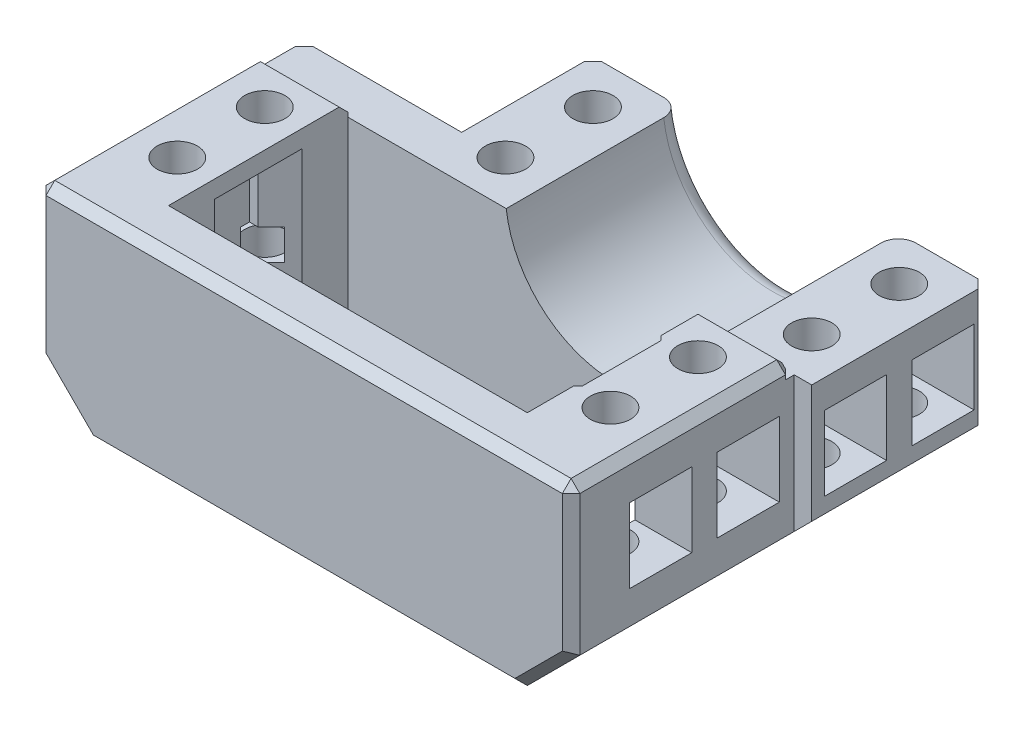
from build123d import *

# Parameters (mm, degrees)
SKETCH1_W           = 41
SKETCH1_H           = 20.5
BOSS_EXTRUDE1_DEPTH = 23
SKETCH2_R           = 12.5
CUT_EXTRUDE1_DEPTH  = 20
SKETCH3_W           = 20
SKETCH3_H           = 23
BOSS_EXTRUDE2_DEPTH = 2
CUT_EXTRUDE2_REACH  = 52.003
SKETCH4_R           = 2.3
CUT_EXTRUDE3_REACH  = 52.003
SKETCH5_R           = 2.3
CUT_EXTRUDE4_DEPTH  = 15
CUT_EXTRUDE5_START  = -9
SKETCH7_W           = 7.1
SKETCH7_H           = 3.5
CUT_EXTRUDE5_DEPTH  = 68.898747864
FILLET1_R           = 2
SKETCH8_W           = 7.1
SKETCH8_H           = 3.5
CUT_EXTRUDE6_DEPTH  = 9
CHAMFER2_SIZE       = 5
CHAMFER4_SIZE       = 5
CHAMFER5_SIZE       = 1
CHAMFER6_SIZE       = 6
CHAMFER7_SIZE       = 1
CUT_EXTRUDE7_START  = -10
SKETCH9_W           = 64.406379258
SKETCH9_H           = 20
CUT_EXTRUDE7_DEPTH  = 1.5
CHAMFER8_SIZE       = 1
CUT_EXTRUDE8_REACH  = 69.32
CUT_EXTRUDE8_START  = -12
CHAMFER9_SIZE       = 2.5


with BuildPart() as part:
    # Sketch1 → Boss-Extrude1 (new body)
    with BuildSketch(Plane(origin=(0, 0, 0), x_dir=(1, 0, 0), z_dir=(0, 1, 0))):
        Polygon((0, -15.25), (-30.5, -15.25), (-30.5, 30.25), (30.5, 30.25), (30.5, -15.25), align=None)
        Rectangle(SKETCH1_W, SKETCH1_H, mode=Mode.SUBTRACT)
    extrude(amount=BOSS_EXTRUDE1_DEPTH)

    # Sketch2 → Cut-Extrude1 (cut)
    with BuildSketch(Plane(origin=(0, 0, -30.25), x_dir=(-1, 0, 0), z_dir=(0, 0, -1))):
        with Locations((-10, 23)):
            Circle(SKETCH2_R)
    extrude(amount=-CUT_EXTRUDE1_DEPTH, mode=Mode.SUBTRACT)

    # Sketch3 → Boss-Extrude2 (add)
    with BuildSketch(Plane(origin=(30.5, 0, 0), x_dir=(0, 0, -1), z_dir=(1, 0, 0))):
        with Locations((20.25, 11.5)):
            Rectangle(SKETCH3_W, SKETCH3_H)
    extrude(amount=BOSS_EXTRUDE2_DEPTH)

    # Sketch4 → Cut-Extrude2 (cut, up to next)
    with BuildSketch(Plane(origin=(0, 23, 0), x_dir=(1, 0, 0), z_dir=(0, 1, 0)), mode=Mode.PRIVATE) as cut_extrude2_sk1:
        with Locations(Location((-7.5, 25.25, 0), (0, 0, 270))):
            Circle(SKETCH4_R)
    cut_extrude2_tool1 = extrude(cut_extrude2_sk1.sketch, amount=-CUT_EXTRUDE2_REACH, mode=Mode.PRIVATE) & part.part
    # Sketch4 → Cut-Extrude2 (cut, up to next)
    with BuildSketch(Plane(origin=(0, 23, 0), x_dir=(1, 0, 0), z_dir=(0, 1, 0)), mode=Mode.PRIVATE) as cut_extrude2_sk2:
        with Locations(Location((-7.5, 15.25, 0), (0, 0, 270))):
            Circle(SKETCH4_R)
    cut_extrude2_tool2 = extrude(cut_extrude2_sk2.sketch, amount=-CUT_EXTRUDE2_REACH, mode=Mode.PRIVATE) & part.part
    # Sketch4 → Cut-Extrude2 (cut, up to next)
    with BuildSketch(Plane(origin=(0, 23, 0), x_dir=(1, 0, 0), z_dir=(0, 1, 0)), mode=Mode.PRIVATE) as cut_extrude2_sk3:
        with Locations(Location((27.5, 25.25, 0), (0, 0, 270))):
            Circle(SKETCH4_R)
    cut_extrude2_tool3 = extrude(cut_extrude2_sk3.sketch, amount=-CUT_EXTRUDE2_REACH, mode=Mode.PRIVATE) & part.part
    # Sketch4 → Cut-Extrude2 (cut, up to next)
    with BuildSketch(Plane(origin=(0, 23, 0), x_dir=(1, 0, 0), z_dir=(0, 1, 0)), mode=Mode.PRIVATE) as cut_extrude2_sk4:
        with Locations(Location((27.5, 15.25, 0), (0, 0, 270))):
            Circle(SKETCH4_R)
    cut_extrude2_tool4 = extrude(cut_extrude2_sk4.sketch, amount=-CUT_EXTRUDE2_REACH, mode=Mode.PRIVATE) & part.part
    add(cut_extrude2_tool1.solids().sort_by_distance((-7.5, 23, -25.25))[0], mode=Mode.SUBTRACT)
    add(cut_extrude2_tool2.solids().sort_by_distance((-7.5, 23, -15.25))[0], mode=Mode.SUBTRACT)
    add(cut_extrude2_tool3.solids().sort_by_distance((27.5, 23, -25.25))[0], mode=Mode.SUBTRACT)
    add(cut_extrude2_tool4.solids().sort_by_distance((27.5, 23, -15.25))[0], mode=Mode.SUBTRACT)

    # Sketch5 → Cut-Extrude3 (cut, up to next)
    with BuildSketch(Plane(origin=(0, 23, 0), x_dir=(1, 0, 0), z_dir=(0, 1, 0)), mode=Mode.PRIVATE) as cut_extrude3_sk1:
        with Locations(Location((24.75, 5, 0), (0, 0, 270))):
            Circle(SKETCH5_R)
    cut_extrude3_tool1 = extrude(cut_extrude3_sk1.sketch, amount=-CUT_EXTRUDE3_REACH, mode=Mode.PRIVATE) & part.part
    # Sketch5 → Cut-Extrude3 (cut, up to next)
    with BuildSketch(Plane(origin=(0, 23, 0), x_dir=(1, 0, 0), z_dir=(0, 1, 0)), mode=Mode.PRIVATE) as cut_extrude3_sk2:
        with Locations(Location((24.75, -5, 0), (0, 0, 270))):
            Circle(SKETCH5_R)
    cut_extrude3_tool2 = extrude(cut_extrude3_sk2.sketch, amount=-CUT_EXTRUDE3_REACH, mode=Mode.PRIVATE) & part.part
    cut_extrude3_1 = cut_extrude3_tool1.solids().sort_by_distance((24.75, 23, -5))[0]
    add(cut_extrude3_1, mode=Mode.SUBTRACT)
    cut_extrude3_2 = cut_extrude3_tool2.solids().sort_by_distance((24.75, 23, 5))[0]
    add(cut_extrude3_2, mode=Mode.SUBTRACT)
    cut_extrude3 = cut_extrude3_1 + cut_extrude3_2  # Cut-Extrude3 as one shape, for the pattern or mirror that repeats it

    # Mirror1: Cut-Extrude3 across plane
    add(cut_extrude3.mirror(Plane(origin=(0, 0, 0), x_dir=(0, 0, 1), z_dir=(1, 0, 0))), mode=Mode.SUBTRACT)

    # Sketch6 → Cut-Extrude4 (cut)
    with BuildSketch(Plane(origin=(0, 0, -30.25), x_dir=(-1, 0, 0), z_dir=(0, 0, -1))):
        Polygon((12.5, 23), (12.5, 19), (12.5, 4), (12.5, 0), (30.5, 0), (30.5, 4), (30.5, 19), (30.5, 23), align=None)
    extrude(amount=-CUT_EXTRUDE4_DEPTH, mode=Mode.SUBTRACT)

    # Sketch7 → Cut-Extrude5 (cut)
    with BuildSketch(Plane.ZY.offset(12.5).offset(CUT_EXTRUDE5_START)):
        with Locations((-25.25, 11.5)):
            Rectangle(SKETCH7_W, SKETCH7_H)
        with Locations((-15.25, 11.5)):
            Rectangle(SKETCH7_W, SKETCH7_H)
    cut_extrude5 = extrude(amount=CUT_EXTRUDE5_DEPTH, mode=Mode.SUBTRACT)

    # Fillet1
    fillet1_edges = [part.edges().sort_by_distance(p)[0] for p in [
        (10, 10.5, -30.25),
    ]]
    fillet(fillet1_edges, radius=FILLET1_R)

    # Mirror2: Cut-Extrude5 across plane
    add(cut_extrude5.mirror(Plane.ZY.offset(-10)), mode=Mode.SUBTRACT)

    # Sketch8 → Cut-Extrude6 (cut)
    with BuildSketch(Plane(origin=(30.5, 0, 0), x_dir=(0, 0, -1), z_dir=(1, 0, 0))):
        with Locations((-5, 11.5)):
            Rectangle(SKETCH8_W, SKETCH8_H)
        with Locations((5, 11.5)):
            Rectangle(SKETCH8_W, SKETCH8_H)
    cut_extrude6 = extrude(amount=-CUT_EXTRUDE6_DEPTH, mode=Mode.SUBTRACT)

    # Mirror3: Cut-Extrude6 across plane
    add(cut_extrude6.mirror(Plane(origin=(0, 0, 0), x_dir=(0, 0, 1), z_dir=(1, 0, 0))), mode=Mode.SUBTRACT)

    # Chamfer2
    # the kernel refuses this chamfer: 5 mm, written as the material it takes off along each edge
    with BuildSketch(Plane(origin=(-12.5, 13.25, -8.84158506), x_dir=(-0.027495876610586317, 0.9996219169112968, 0), z_dir=(0, 0, -1))) as chamfer2_piece_1_section:
        Polygon((CHAMFER2_SIZE * 0.999621916911, CHAMFER2_SIZE * 0.0274958766106), (-CHAMFER2_SIZE * 0.0274958766106, CHAMFER2_SIZE * 0.999621916911), (0, 0), align=None)
    chamfer2_piece_1 = extrude(amount=32.81682988, mode=Mode.PRIVATE)
    chamfer2_piece_1 = split(chamfer2_piece_1, bisect_by=Plane(origin=(-11.032350108, 15.016175054, -15.25), z_dir=(0, 0, -1)), keep=Keep.TOP, mode=Mode.PRIVATE)
    chamfer2_piece_1 = split(chamfer2_piece_1, bisect_by=Plane(origin=(-11.032350108, 15.016175054, -18.8), z_dir=(0, 0, 1)), keep=Keep.TOP, mode=Mode.PRIVATE)
    add(chamfer2_piece_1, mode=Mode.SUBTRACT)
    with BuildSketch(Plane(origin=(-12.5, 13.25, -21.7), x_dir=(-0.027495876610586327, 0.9996219169112968, 0), z_dir=(0, 0, -1)), Plane(origin=(32.5, 13.25, -18.8), x_dir=(0.027495876610586317, 0.9996219169112968, 0), z_dir=(0, 0, 1)), Plane(origin=(32.5, 13.25, -28.8), x_dir=(0.027495876610586327, 0.9996219169112968, 0), z_dir=(0, 0, 1)), Plane(origin=(30.5, 13.25, 1.45), x_dir=(0.027495876610586317, 0.9996219169112968, 0), z_dir=(0, 0, 1)), Plane(origin=(-30.5, 13.25, -1.45), x_dir=(-0.027495876610586317, 0.9996219169112968, 0), z_dir=(0, 0, -1))) as chamfer2_piece_2:
        Polygon((CHAMFER2_SIZE * 0.999621916911, CHAMFER2_SIZE * 0.0274958766106), (-CHAMFER2_SIZE * 0.0274958766106, CHAMFER2_SIZE * 0.999621916911), (0, 0), align=None)
    extrude(amount=7.1, mode=Mode.SUBTRACT)
    with BuildSketch(Plane(origin=(-12.5, 13.25, -15.25), x_dir=(-0.027495876610586327, 0.9996219169112968, 0), z_dir=(0, 0, -1))) as chamfer2_piece_3:
        Polygon((CHAMFER2_SIZE * 0.999621916911, CHAMFER2_SIZE * 0.0274958766106), (-CHAMFER2_SIZE * 0.0274958766106, CHAMFER2_SIZE * 0.999621916911), (0, 0), align=None)
    extrude(amount=3.55, mode=Mode.SUBTRACT)
    with BuildSketch(Plane(origin=(-12.5, 13.25, -2.39158506), x_dir=(-0.02749587661058631, 0.9996219169112968, 0), z_dir=(0, 0, -1))) as chamfer2_piece_4_section:
        Polygon((CHAMFER2_SIZE * 0.999621916911, CHAMFER2_SIZE * 0.0274958766106), (-CHAMFER2_SIZE * 0.0274958766106, CHAMFER2_SIZE * 0.999621916911), (0, 0), align=None)
    chamfer2_piece_4 = extrude(amount=29.26682988, mode=Mode.PRIVATE)
    chamfer2_piece_4 = split(chamfer2_piece_4, bisect_by=Plane(origin=(-11.032350109, 15.016175054, -21.7), z_dir=(0, 0, -1)), keep=Keep.TOP, mode=Mode.PRIVATE)
    chamfer2_piece_4 = split(chamfer2_piece_4, bisect_by=Plane(origin=(-11.032350109, 15.016175054, -28.8), z_dir=(0, 0, 1)), keep=Keep.TOP, mode=Mode.PRIVATE)
    add(chamfer2_piece_4, mode=Mode.SUBTRACT)
    with BuildSketch(Plane(origin=(32.5, 13.25, -31.65841494), x_dir=(0.027495876610586317, 0.9996219169112968, 0), z_dir=(0, 0, 1))) as chamfer2_piece_5_section:
        Polygon((CHAMFER2_SIZE * 0.999621916911, CHAMFER2_SIZE * 0.0274958766106), (-CHAMFER2_SIZE * 0.0274958766106, CHAMFER2_SIZE * 0.999621916911), (0, 0), align=None)
    chamfer2_piece_5 = extrude(amount=32.81682988, mode=Mode.PRIVATE)
    chamfer2_piece_5 = split(chamfer2_piece_5, bisect_by=Plane(origin=(31.583333333, 15.291666667, -28.8), z_dir=(0, 0, 1)), keep=Keep.TOP, mode=Mode.PRIVATE)
    chamfer2_piece_5 = split(chamfer2_piece_5, bisect_by=Plane(origin=(31.583333333, 15.291666667, -21.7), z_dir=(0, 0, -1)), keep=Keep.TOP, mode=Mode.PRIVATE)
    add(chamfer2_piece_5, mode=Mode.SUBTRACT)
    with BuildSketch(Plane(origin=(32.5, 13.25, -31.65841494), x_dir=(0.027495876610586317, 0.9996219169112968, 0), z_dir=(0, 0, 1))) as chamfer2_piece_6_section:
        Polygon((CHAMFER2_SIZE * 0.999621916911, CHAMFER2_SIZE * 0.0274958766106), (-CHAMFER2_SIZE * 0.0274958766106, CHAMFER2_SIZE * 0.999621916911), (0, 0), align=None)
    chamfer2_piece_6 = extrude(amount=32.81682988, mode=Mode.PRIVATE)
    chamfer2_piece_6 = split(chamfer2_piece_6, bisect_by=Plane(origin=(29.5, 14.25, -8.55), z_dir=(0, 0, 1)), keep=Keep.TOP, mode=Mode.PRIVATE)
    chamfer2_piece_6 = split(chamfer2_piece_6, bisect_by=Plane(origin=(29.5, 14.25, -1.45), z_dir=(0, 0, -1)), keep=Keep.TOP, mode=Mode.PRIVATE)
    add(chamfer2_piece_6, mode=Mode.SUBTRACT)
    with BuildSketch(Plane(origin=(32.5, 13.25, -41.65841494), x_dir=(0.02749587661058631, 0.9996219169112968, 0), z_dir=(0, 0, 1))) as chamfer2_piece_7_section:
        Polygon((CHAMFER2_SIZE * 0.999621916911, CHAMFER2_SIZE * 0.0274958766106), (-CHAMFER2_SIZE * 0.0274958766106, CHAMFER2_SIZE * 0.999621916911), (0, 0), align=None)
    chamfer2_piece_7 = extrude(amount=32.81682988, mode=Mode.PRIVATE)
    chamfer2_piece_7 = split(chamfer2_piece_7, bisect_by=Plane(origin=(31.583333333, 15.291666667, -18.8), z_dir=(0, 0, 1)), keep=Keep.TOP, mode=Mode.PRIVATE)
    chamfer2_piece_7 = split(chamfer2_piece_7, bisect_by=Plane(origin=(31.583333333, 15.291666667, -11.7), z_dir=(0, 0, -1)), keep=Keep.TOP, mode=Mode.PRIVATE)
    add(chamfer2_piece_7, mode=Mode.SUBTRACT)
    with BuildSketch(Plane(origin=(30.5, 13.25, -11.40841494), x_dir=(0.027495876610586317, 0.9996219169112968, 0), z_dir=(0, 0, 1))) as chamfer2_piece_8_section:
        Polygon((CHAMFER2_SIZE * 0.999621916911, CHAMFER2_SIZE * 0.0274958766106), (-CHAMFER2_SIZE * 0.0274958766106, CHAMFER2_SIZE * 0.999621916911), (0, 0), align=None)
    chamfer2_piece_8 = extrude(amount=32.81682988, mode=Mode.PRIVATE)
    chamfer2_piece_8 = split(chamfer2_piece_8, bisect_by=Plane(origin=(28.923121447, 14.961560723, -8.55), z_dir=(0, 0, 1)), keep=Keep.TOP, mode=Mode.PRIVATE)
    chamfer2_piece_8 = split(chamfer2_piece_8, bisect_by=Plane(origin=(28.923121447, 14.961560723, -1.45), z_dir=(0, 0, -1)), keep=Keep.TOP, mode=Mode.PRIVATE)
    add(chamfer2_piece_8, mode=Mode.SUBTRACT)
    with BuildSketch(Plane(origin=(30.5, 13.25, 11.40841494), x_dir=(0.027495876610586317, 0.9996219169112968, 0), z_dir=(0, 0, -1))) as chamfer2_piece_9_section:
        Polygon((CHAMFER2_SIZE * 0.999621916911, -CHAMFER2_SIZE * 0.0274958766106), (-CHAMFER2_SIZE * 0.0274958766106, -CHAMFER2_SIZE * 0.999621916911), (0, 0), align=None)
    chamfer2_piece_9 = extrude(amount=32.81682988, mode=Mode.PRIVATE)
    chamfer2_piece_9 = split(chamfer2_piece_9, bisect_by=Plane(origin=(28.923121447, 14.961560723, 1.45), z_dir=(0, 0, 1)), keep=Keep.TOP, mode=Mode.PRIVATE)
    chamfer2_piece_9 = split(chamfer2_piece_9, bisect_by=Plane(origin=(28.923121447, 14.961560723, 8.55), z_dir=(0, 0, -1)), keep=Keep.TOP, mode=Mode.PRIVATE)
    add(chamfer2_piece_9, mode=Mode.SUBTRACT)
    with BuildSketch(Plane(origin=(30.5, 13.25, -1.45), x_dir=(0.027495876610586317, 0.9996219169112968, 0), z_dir=(0, 0, -1)), Plane(origin=(-30.5, 13.25, 1.45), x_dir=(-0.027495876610586317, 0.9996219169112968, 0), z_dir=(0, 0, 1))) as chamfer2_piece_10:
        Polygon((CHAMFER2_SIZE * 0.999621916911, -CHAMFER2_SIZE * 0.0274958766106), (-CHAMFER2_SIZE * 0.0274958766106, -CHAMFER2_SIZE * 0.999621916911), (0, 0), align=None)
    extrude(amount=7.1, mode=Mode.SUBTRACT)
    with BuildSketch(Plane(origin=(-30.5, 13.25, -11.40841494), x_dir=(-0.027495876610586317, 0.9996219169112968, 0), z_dir=(0, 0, 1))) as chamfer2_piece_11_section:
        Polygon((CHAMFER2_SIZE * 0.999621916911, -CHAMFER2_SIZE * 0.0274958766106), (-CHAMFER2_SIZE * 0.0274958766106, -CHAMFER2_SIZE * 0.999621916911), (0, 0), align=None)
    chamfer2_piece_11 = extrude(amount=32.81682988, mode=Mode.PRIVATE)
    chamfer2_piece_11 = split(chamfer2_piece_11, bisect_by=Plane(origin=(-28.923121447, 14.961560723, -1.45), z_dir=(0, 0, -1)), keep=Keep.TOP, mode=Mode.PRIVATE)
    chamfer2_piece_11 = split(chamfer2_piece_11, bisect_by=Plane(origin=(-28.923121447, 14.961560723, -8.55), z_dir=(0, 0, 1)), keep=Keep.TOP, mode=Mode.PRIVATE)
    add(chamfer2_piece_11, mode=Mode.SUBTRACT)
    with BuildSketch(Plane(origin=(-30.5, 13.25, 11.40841494), x_dir=(-0.027495876610586317, 0.9996219169112968, 0), z_dir=(0, 0, -1))) as chamfer2_piece_12_section:
        Polygon((CHAMFER2_SIZE * 0.999621916911, CHAMFER2_SIZE * 0.0274958766106), (-CHAMFER2_SIZE * 0.0274958766106, CHAMFER2_SIZE * 0.999621916911), (0, 0), align=None)
    chamfer2_piece_12 = extrude(amount=32.81682988, mode=Mode.PRIVATE)
    chamfer2_piece_12 = split(chamfer2_piece_12, bisect_by=Plane(origin=(-28.923121447, 14.961560723, 8.55), z_dir=(0, 0, -1)), keep=Keep.TOP, mode=Mode.PRIVATE)
    chamfer2_piece_12 = split(chamfer2_piece_12, bisect_by=Plane(origin=(-28.923121447, 14.961560723, 1.45), z_dir=(0, 0, 1)), keep=Keep.TOP, mode=Mode.PRIVATE)
    add(chamfer2_piece_12, mode=Mode.SUBTRACT)

    # Chamfer3
    # the kernel refuses this chamfer: 8 mm, written as the material it takes off along each edge
    with BuildSketch(Plane(origin=(32.5, 0, 39.126313369), x_dir=(-0.9996219169112968, -0.027495876610586365, 0), z_dir=(0, 0, -1))) as chamfer3_piece_1:
        with BuildLine():
            Line((8.229385561, 0), (-0.452377239, 8.216942348))
            Line((-0.452377239, 8.216942348), (-0.612316746, 8.212543008))
            ThreePointArc((-0.612316746, 8.212543008), (-0.273033816, 4.107182637), (-0.159939507, -0.00439934))
            Line((-0.159939507, -0.00439934), (0.00439934, -0.159939507))
            ThreePointArc((0.00439934, -0.159939507), (4.115981318, -0.046845197), (8.233784902, -0.159939507))
            Line((8.233784902, -0.159939507), (8.229385561, 0))
        make_face()
    extrude(amount=118.752626738, mode=Mode.SUBTRACT)

    # Chamfer4
    # the kernel refuses this chamfer: 5 mm, written as the material it takes off along each edge
    with BuildSketch(Plane(origin=(-12.5, 0, -43.10841494), x_dir=(-0.027495876610586317, 0.9996219169112968, 0), z_dir=(0, 0, 1))) as chamfer4_piece_1:
        Polygon((CHAMFER4_SIZE * 0.999621916911, -CHAMFER4_SIZE * 0.0274958766106), (-CHAMFER4_SIZE * 0.0274958766106, -CHAMFER4_SIZE * 0.999621916911), (0, 0), align=None)
    extrude(amount=27.85841494, mode=Mode.SUBTRACT)

    # Chamfer5
    chamfer5_edges = [part.edges().sort_by_distance(p)[0] for p in [
        (-12.5, 14, -30.25),
        (32.5, 15.5, -30.25),
        (8.5, 0, -30.25),
        (28.5, 4, -30.25),
        (-10, 2.5, -30.25),
    ]]
    chamfer(chamfer5_edges, length=CHAMFER5_SIZE)

    # Chamfer6
    # the kernel refuses this chamfer: 6 mm, written as the material it takes off along each edge
    with BuildSketch(Plane(origin=(-30.5, 0, 30.680097928), x_dir=(-0.027495876610586202, 0.9996219169112968, 0), z_dir=(0, 0, -1))) as chamfer6_piece_1:
        Polygon((CHAMFER6_SIZE * 0.999621916911, CHAMFER6_SIZE * 0.0274958766106), (-CHAMFER6_SIZE * 0.0274958766106, CHAMFER6_SIZE * 0.999621916911), (0, 0), align=None)
    extrude(amount=61.360195856, mode=Mode.SUBTRACT)

    # Chamfer7
    chamfer7_edges = [part.edges().sort_by_distance(p)[0] for p in [
        (-17.15, 0, -15.25),
        (-30.5, 18.125, -15.25),
        (-21.5, 9.75, -15.25),
        (-20.15, 13.25, -15.25),
        (27.5, 3, 15.25),
        (-30.5, 7.875, -15.25),
        (0, 0, 15.25),
        (-27.5, 3, 15.25),
        (-27.5, 3, -15.25),
        (0, 23, 15.25),
        (30.5, 23, 2.5),
        (-30.5, 23, 0),
        (-30.5, 14.5, 15.25),
        (30.5, 14.5, 15.25),
    ]]
    chamfer(chamfer7_edges, length=CHAMFER7_SIZE)

    # Sketch9 → Cut-Extrude7 (cut)
    with BuildSketch(Plane(origin=(0, 33, 0), x_dir=(1, 0, 0), z_dir=(0, 1, 0)).offset(CUT_EXTRUDE7_START)):
        with Locations((0.296810371, 20.25)):
            Rectangle(SKETCH9_W, SKETCH9_H)
    extrude(amount=-CUT_EXTRUDE7_DEPTH, mode=Mode.SUBTRACT)

    # Chamfer8
    chamfer8_edges = [part.edges().sort_by_distance(p)[0] for p in [
        (25, 23, -10.25),
        (30.5, 21.75, -10.25),
        (30, 22.5, -10.25),
        (-25, 23, -10.25),
        (-30, 22.5, -10.25),
        (-30.5, 21.75, -10.25),
    ]]
    chamfer(chamfer8_edges, length=CHAMFER8_SIZE)

    # Sketch10 → Cut-Extrude8 (cut, up to next)
    with BuildSketch(Plane(origin=(0, 33, 0), x_dir=(1, 0, 0), z_dir=(0, 1, 0)).offset(CUT_EXTRUDE8_START), mode=Mode.PRIVATE) as cut_extrude8_sk1:
        Polygon((-20.5, 2.5), (-24, 2.5), (-24, -2.5), (-20.5, -2.5), (-20.5, 0), align=None)
    cut_extrude8_tool1 = extrude(cut_extrude8_sk1.sketch, amount=-CUT_EXTRUDE8_REACH, mode=Mode.PRIVATE) & part.part
    cut_extrude8 = cut_extrude8_tool1.solids().sort_by_distance((-22.25, 21, 0))[0]
    add(cut_extrude8, mode=Mode.SUBTRACT)

    # Chamfer9
    # the kernel refuses this chamfer: 2.5 mm, written as the material it takes off along each edge
    with BuildSketch(Plane(origin=(-20.5, 21, 2.5), x_dir=(0.027495876610586317, 0, 0.9996219169112968), z_dir=(0, -1, 0))) as chamfer9_piece_1:
        Polygon((CHAMFER9_SIZE * 0.999621916911, CHAMFER9_SIZE * 0.0274958766106), (-CHAMFER9_SIZE * 0.0274958766106, CHAMFER9_SIZE * 0.999621916911), (0, 0), align=None)
    extrude(amount=27.42920747, mode=Mode.SUBTRACT)
    with BuildSketch(Plane(origin=(-20.5, 21, -2.5), x_dir=(0.027495876610586324, 0, -0.9996219169112968), z_dir=(0, -1, 0))) as chamfer9_piece_2:
        Polygon((CHAMFER9_SIZE * 0.999621916911, -CHAMFER9_SIZE * 0.0274958766106), (-CHAMFER9_SIZE * 0.0274958766106, -CHAMFER9_SIZE * 0.999621916911), (0, 0), align=None)
    extrude(amount=27.42920747, mode=Mode.SUBTRACT)

    # Mirror4: Cut-Extrude8 across plane
    add(cut_extrude8.mirror(Plane(origin=(0, 0, 0), x_dir=(0, 0, 1), z_dir=(1, 0, 0))), mode=Mode.SUBTRACT)

    # Chamfer10
    # the kernel refuses this chamfer: 2.5 mm, written as the material it takes off along each edge
    with BuildSketch(Plane(origin=(20.5, 21, -2.5), x_dir=(-0.027495876610586324, 0, -0.9996219169112968), z_dir=(0, -1, 0))) as chamfer10_piece_1:
        with BuildLine():
            Line((2.571682988, 0), (-0.141367887, 2.567794484))
            Line((-0.141367887, 2.567794484), (-0.191348983, 2.56641969))
            ThreePointArc((-0.191348983, 2.56641969), (-0.085323068, 1.283494574), (-0.049981096, -0.001374794))
            Line((-0.049981096, -0.001374794), (0.001374794, -0.049981096))
            ThreePointArc((0.001374794, -0.049981096), (1.286244162, -0.014639124), (2.573057782, -0.049981096))
            Line((2.573057782, -0.049981096), (2.571682988, 0))
        make_face()
    extrude(amount=21, mode=Mode.SUBTRACT)
    with BuildSketch(Plane(origin=(20.5, 21, -2.5), x_dir=(-0.027495876610586317, 0.9996219169112968, 0), z_dir=(0, 0, 1))) as chamfer10_piece_2:
        with BuildLine():
            Line((2.571682988, 0), (-0.141367887, -2.567794484))
            Line((-0.141367887, -2.567794484), (-0.191348983, -2.56641969))
            ThreePointArc((-0.191348983, -2.56641969), (-0.085323068, -1.283494574), (-0.049981096, 0.001374794))
            Line((-0.049981096, 0.001374794), (0.001374794, 0.049981096))
            ThreePointArc((0.001374794, 0.049981096), (1.286244162, 0.014639124), (2.573057782, 0.049981096))
            Line((2.573057782, 0.049981096), (2.571682988, 0))
        make_face()
    extrude(amount=5, mode=Mode.SUBTRACT)
    with BuildSketch(Plane(origin=(20.5, 21, 2.5), x_dir=(-0.027495876610586317, 0, 0.9996219169112968), z_dir=(0, -1, 0))) as chamfer10_piece_3:
        with BuildLine():
            Line((2.571682988, 0), (-0.141367887, -2.567794484))
            Line((-0.141367887, -2.567794484), (-0.191348983, -2.56641969))
            ThreePointArc((-0.191348983, -2.56641969), (-0.085323068, -1.283494574), (-0.049981096, 0.001374794))
            Line((-0.049981096, 0.001374794), (0.001374794, 0.049981096))
            ThreePointArc((0.001374794, 0.049981096), (1.286244162, 0.014639124), (2.573057782, 0.049981096))
            Line((2.573057782, 0.049981096), (2.571682988, 0))
        make_face()
    extrude(amount=21, mode=Mode.SUBTRACT)
    with BuildSketch(Plane(origin=(20.5, 27.42920747, -2.5), x_dir=(-0.027495876610586317, 0, -0.9996219169112968), z_dir=(0, -1, 0))) as chamfer10_piece_4a_section:
        with BuildLine():
            Line((2.571682988, 0), (-0.141367887, 2.567794484))
            Line((-0.141367887, 2.567794484), (-0.191348983, 2.56641969))
            ThreePointArc((-0.191348983, 2.56641969), (-0.085323068, 1.283494574), (-0.049981096, -0.001374794))
            Line((-0.049981096, -0.001374794), (0.001374794, -0.049981096))
            ThreePointArc((0.001374794, -0.049981096), (1.286244162, -0.014639124), (2.573057782, -0.049981096))
            Line((2.573057782, -0.049981096), (2.571682988, 0))
        make_face()
    chamfer10_piece_4a = extrude(amount=27.42920747, mode=Mode.PRIVATE)
    chamfer10_piece_4a = split(chamfer10_piece_4a, bisect_by=Plane(origin=(21.324484067, 21, -3.324484067), z_dir=(0, 1, 0)), keep=Keep.TOP, mode=Mode.PRIVATE)
    with BuildSketch(Plane(origin=(20.5, 21, -8.92920747), x_dir=(-0.027495876610586317, 0.9996219169112968, 0), z_dir=(0, 0, 1))) as chamfer10_piece_4b_section:
        with BuildLine():
            Line((2.571682988, 0), (-0.141367887, -2.567794484))
            Line((-0.141367887, -2.567794484), (-0.191348983, -2.56641969))
            ThreePointArc((-0.191348983, -2.56641969), (-0.085323068, -1.283494574), (-0.049981096, 0.001374794))
            Line((-0.049981096, 0.001374794), (0.001374794, 0.049981096))
            ThreePointArc((0.001374794, 0.049981096), (1.286244162, 0.014639124), (2.573057782, 0.049981096))
            Line((2.573057782, 0.049981096), (2.571682988, 0))
        make_face()
    chamfer10_piece_4b = extrude(amount=11.42920747, mode=Mode.PRIVATE)
    chamfer10_piece_4b = split(chamfer10_piece_4b, bisect_by=Plane(origin=(21.324484067, 21.824484067, -2.5), z_dir=(0, 0, -1)), keep=Keep.TOP, mode=Mode.PRIVATE)
    chamfer10_piece_4 = chamfer10_piece_4a & chamfer10_piece_4b
    add(chamfer10_piece_4, mode=Mode.SUBTRACT)
    with BuildSketch(Plane(origin=(20.5, 21, -2.5), x_dir=(-0.027495876610586317, 0.9996219169112968, 0), z_dir=(0, 0, 1))) as chamfer10_piece_5a_section:
        with BuildLine():
            Line((2.571682988, 0), (-0.141367887, -2.567794484))
            Line((-0.141367887, -2.567794484), (-0.191348983, -2.56641969))
            ThreePointArc((-0.191348983, -2.56641969), (-0.085323068, -1.283494574), (-0.049981096, 0.001374794))
            Line((-0.049981096, 0.001374794), (0.001374794, 0.049981096))
            ThreePointArc((0.001374794, 0.049981096), (1.286244162, 0.014639124), (2.573057782, 0.049981096))
            Line((2.573057782, 0.049981096), (2.571682988, 0))
        make_face()
    chamfer10_piece_5a = extrude(amount=11.42920747, mode=Mode.PRIVATE)
    chamfer10_piece_5a = split(chamfer10_piece_5a, bisect_by=Plane(origin=(21.324484067, 21.824484067, 2.5), z_dir=(0, 0, 1)), keep=Keep.TOP, mode=Mode.PRIVATE)
    with BuildSketch(Plane(origin=(20.5, 27.42920747, 2.5), x_dir=(-0.027495876610586317, 0, 0.9996219169112968), z_dir=(0, -1, 0))) as chamfer10_piece_5b_section:
        with BuildLine():
            Line((2.571682988, 0), (-0.141367887, -2.567794484))
            Line((-0.141367887, -2.567794484), (-0.191348983, -2.56641969))
            ThreePointArc((-0.191348983, -2.56641969), (-0.085323068, -1.283494574), (-0.049981096, 0.001374794))
            Line((-0.049981096, 0.001374794), (0.001374794, 0.049981096))
            ThreePointArc((0.001374794, 0.049981096), (1.286244162, 0.014639124), (2.573057782, 0.049981096))
            Line((2.573057782, 0.049981096), (2.571682988, 0))
        make_face()
    chamfer10_piece_5b = extrude(amount=27.42920747, mode=Mode.PRIVATE)
    chamfer10_piece_5b = split(chamfer10_piece_5b, bisect_by=Plane(origin=(21.324484067, 21, 3.324484067), z_dir=(0, 1, 0)), keep=Keep.TOP, mode=Mode.PRIVATE)
    chamfer10_piece_5 = chamfer10_piece_5a & chamfer10_piece_5b
    add(chamfer10_piece_5, mode=Mode.SUBTRACT)


solid = part.part
